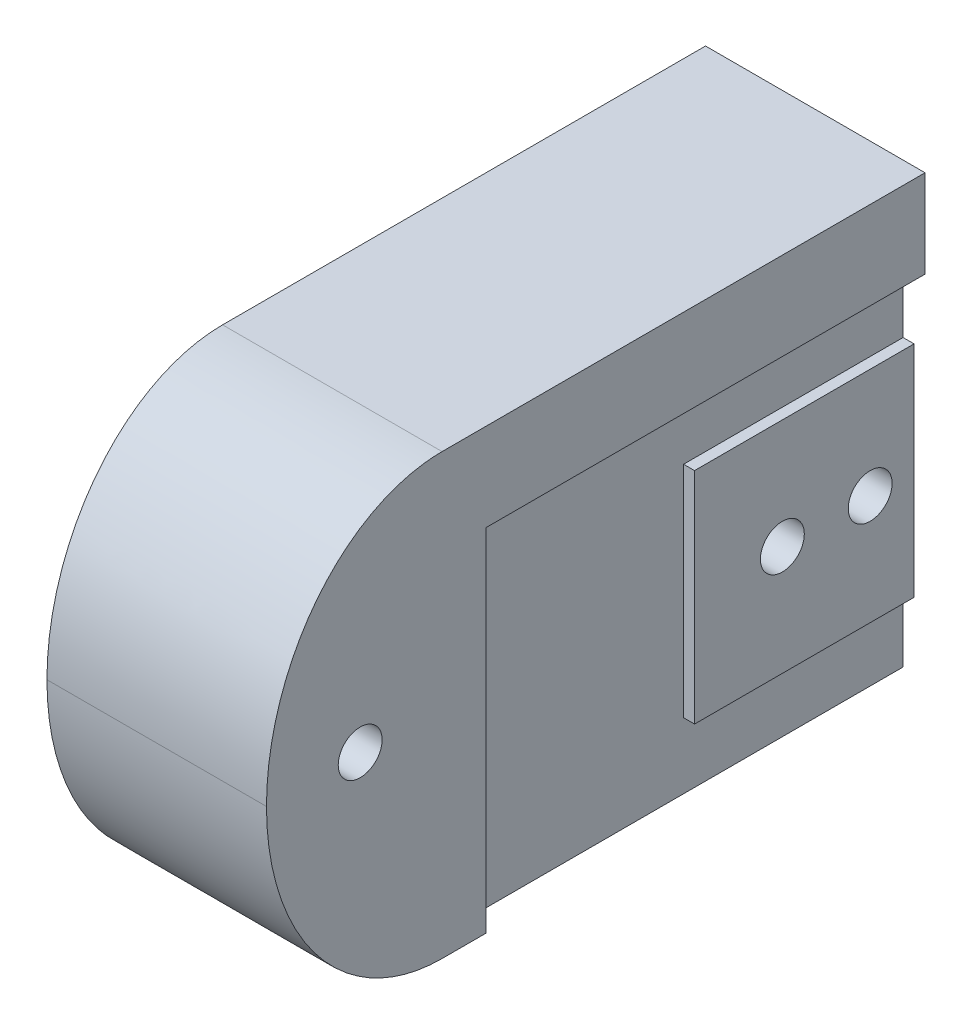
from build123d import *

# Parameters (mm, degrees)
SKIZZE1_W                       = 150
SKIZZE1_H                       = 100
AUFSATZ_LINEAR_AUSTRAGEN1_DEPTH = 50
SKIZZE2_W                       = 100
SKIZZE2_H                       = 80
SCHNITT_LINEAR_AUSTRAGEN1_DEPTH = 5
SKIZZE3_W                       = 50
SKIZZE3_H                       = 50
AUFSATZ_LINEAR_AUSTRAGEN2_DEPTH = 2.5
SKIZZE4_R                       = 5
SCHNITT_LINEAR_AUSTRAGEN2_DEPTH = 10
VERRUNDUNG1_SIZE                = 50
VERRUNDUNG1_SIZE_2              = 40
SKIZZE5_R                       = 5
SCHNITT_LINEAR_AUSTRAGEN3_DEPTH = 380


with BuildPart() as part:
    # Skizze1 → Aufsatz-Linear austragen1 (new body)
    with BuildSketch(Plane(origin=(0, 0, 0), x_dir=(0, 0, -1), z_dir=(1, 0, 0))):
        with Locations((-31.954225352, -9.463028169)):
            Rectangle(SKIZZE1_W, SKIZZE1_H)
    extrude(amount=AUFSATZ_LINEAR_AUSTRAGEN1_DEPTH)

    # Skizze2 → Schnitt-Linear austragen1 (cut)
    with BuildSketch(Plane(origin=(50, 0, 0), x_dir=(0, 0, -1), z_dir=(1, 0, 0))):
        with Locations((-6.954225352, -19.463028169)):
            Rectangle(SKIZZE2_W, SKIZZE2_H)
    extrude(amount=-SCHNITT_LINEAR_AUSTRAGEN1_DEPTH, mode=Mode.SUBTRACT)

    # Skizze3 → Aufsatz-Linear austragen2 (add)
    with BuildSketch(Plane(origin=(45, 0, 0), x_dir=(0, 0, -1), z_dir=(1, 0, 0))):
        with Locations((18.045774648, -19.463028169)):
            Rectangle(SKIZZE3_W, SKIZZE3_H)
    extrude(amount=AUFSATZ_LINEAR_AUSTRAGEN2_DEPTH)

    # Skizze4 → Schnitt-Linear austragen2 (cut)
    with BuildSketch(Plane(origin=(47.5, 0, 0), x_dir=(0, 0, -1), z_dir=(1, 0, 0))):
        with Locations((33.045774648, -19.463028169)):
            Circle(SKIZZE4_R)
        with Locations((13.045774648, -19.463028169)):
            Circle(SKIZZE4_R)
    extrude(amount=-SCHNITT_LINEAR_AUSTRAGEN2_DEPTH, mode=Mode.SUBTRACT)

    # Verrundung1
    # an asymmetric fillet: 50, 40 mm, written as the material it takes off along each edge
    with BuildSketch(Plane(origin=(-125, -59.463028169, 106.954225352), x_dir=(0, 1, 0), z_dir=(1, 0, 0))) as verrundung1_piece_1:
        with BuildLine():
            Bezier((VERRUNDUNG1_SIZE, 0), (0, 0), (0, -VERRUNDUNG1_SIZE_2), weights=[1, 0.707106781, 1])
            Line((0, -VERRUNDUNG1_SIZE_2), (0, 0))
            Line((0, 0), (VERRUNDUNG1_SIZE, 0))
        make_face()
    extrude(amount=300, mode=Mode.SUBTRACT)
    with BuildSketch(Plane(origin=(-125, 40.536971831, 106.954225352), x_dir=(0, 0, -1), z_dir=(1, 0, 0))) as verrundung1_piece_2:
        with BuildLine():
            Bezier((VERRUNDUNG1_SIZE_2, 0), (0, 0), (0, -VERRUNDUNG1_SIZE), weights=[1, 0.707106781, 1])
            Line((0, -VERRUNDUNG1_SIZE), (0, 0))
            Line((0, 0), (VERRUNDUNG1_SIZE_2, 0))
        make_face()
    extrude(amount=300, mode=Mode.SUBTRACT)

    # Skizze5 → Schnitt-Linear austragen3 (cut)
    with BuildSketch(Plane.ZY):
        with Locations((85.614751131, -9.463028169)):
            Circle(SKIZZE5_R)
    extrude(amount=-SCHNITT_LINEAR_AUSTRAGEN3_DEPTH, mode=Mode.SUBTRACT)


solid = part.part
